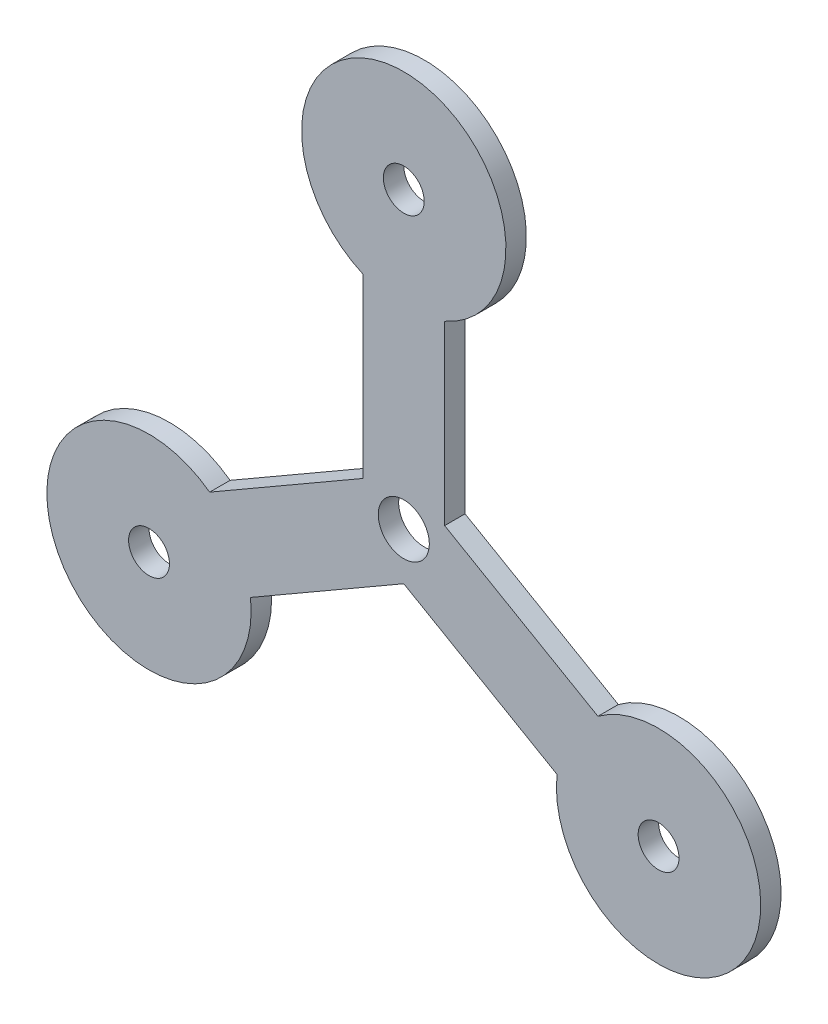
from build123d import *

# Parameters (mm, degrees)
BOSS_EXTRUDE2_DEPTH = 10
SKETCH3_R           = 50
BOSS_EXTRUDE3_DEPTH = 10
SKETCH4_R           = 10
BOSS_EXTRUDE4_DEPTH = 90
CUT_EXTRUDE1_START  = -30
SKETCH5_R           = 10
CUT_EXTRUDE1_DEPTH  = 30
SKETCH6_R           = 13
CUT_EXTRUDE2_DEPTH  = 10
SKETCH7_R           = 10
BOSS_EXTRUDE5_DEPTH = 30
SKETCH8_R           = 20.369169003
BOSS_EXTRUDE6_DEPTH = 10
CUT_EXTRUDE3_START  = -100
SKETCH9_R           = 10
CUT_EXTRUDE3_DEPTH  = 100
SKETCH10_R          = 10
CUT_EXTRUDE4_DEPTH  = 10
SKETCH11_R          = 12.5
CUT_EXTRUDE5_DEPTH  = 10


with BuildPart() as part:
    # Sketch1 → Boss-Extrude2 (new body)
    with BuildSketch(Plane.XY):
        Polygon((20, 144), (-20, 144), (-20, 11.547005384), (-134.707658145, -54.679491924), (-114.707658145, -89.320508076), (0, -23.094010768), (114.707658145, -89.320508076), (134.707658145, -54.679491924), (20, 11.547005384), align=None)
    extrude(amount=BOSS_EXTRUDE2_DEPTH)

    # Sketch3 → Boss-Extrude3 (add)
    with BuildSketch(Plane.XY.offset(10)):
        with Locations((-124.707658145, -72)):
            Circle(SKETCH3_R)
        with Locations((0, 144)):
            Circle(SKETCH3_R)
        with Locations((124.707658145, -72)):
            Circle(SKETCH3_R)
    extrude(amount=-BOSS_EXTRUDE3_DEPTH)

    # Sketch4 → Boss-Extrude4 (add)
    with BuildSketch(Plane.XY.offset(10)):
        with Locations((0, 144)):
            Circle(SKETCH4_R)
        with Locations((124.707658145, -72)):
            Circle(SKETCH4_R)
        with Locations((-124.707658145, -72)):
            Circle(SKETCH4_R)
    extrude(amount=BOSS_EXTRUDE4_DEPTH)

    # Sketch5 → Cut-Extrude1 (cut)
    with BuildSketch(Plane.XY.offset(100).offset(CUT_EXTRUDE1_START)):
        with Locations((0, 144)):
            Circle(SKETCH5_R)
    extrude(amount=CUT_EXTRUDE1_DEPTH, mode=Mode.SUBTRACT)

    # Sketch6 → Cut-Extrude2 (cut)
    with BuildSketch(Plane.XY.offset(10)):
        Circle(SKETCH6_R)
    extrude(amount=-CUT_EXTRUDE2_DEPTH, mode=Mode.SUBTRACT)

    # Sketch7 → Boss-Extrude5 (add)
    with BuildSketch(Plane.XY.offset(70)):
        with Locations((0, 144)):
            Circle(SKETCH7_R)
    extrude(amount=BOSS_EXTRUDE5_DEPTH)

    # Sketch8 → Boss-Extrude6 (add)
    with BuildSketch(Plane.XY.offset(10)):
        Circle(SKETCH8_R)
    extrude(amount=-BOSS_EXTRUDE6_DEPTH)

    # Sketch9 → Cut-Extrude3 (cut)
    with BuildSketch(Plane.XY.offset(100).offset(CUT_EXTRUDE3_START)):
        with Locations((-124.707658145, -72)):
            Circle(SKETCH9_R)
        with Locations((0, 144)):
            Circle(SKETCH9_R)
        with Locations((124.707658145, -72)):
            Circle(SKETCH9_R)
    extrude(amount=CUT_EXTRUDE3_DEPTH, mode=Mode.SUBTRACT)

    # Sketch10 → Cut-Extrude4 (cut)
    with BuildSketch(Plane.XY.offset(10)):
        Circle(SKETCH10_R)
    extrude(amount=-CUT_EXTRUDE4_DEPTH, mode=Mode.SUBTRACT)

    # Sketch11 → Cut-Extrude5 (cut)
    with BuildSketch(Plane.XY.offset(10)):
        Circle(SKETCH11_R)
    extrude(amount=-CUT_EXTRUDE5_DEPTH, mode=Mode.SUBTRACT)


solid = part.part
